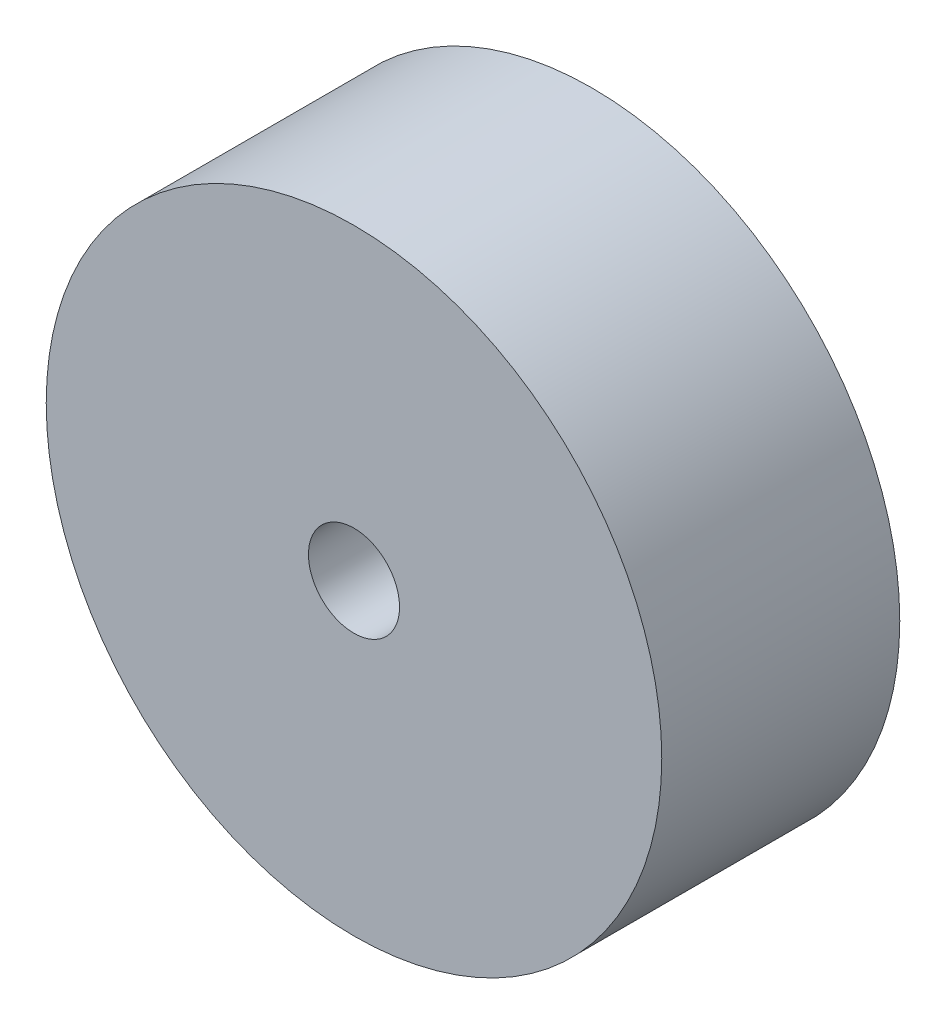
from build123d import *

# Parameters (mm, degrees)
SKETCH1_R           = 7.5
BOSS_EXTRUDE1_DEPTH = 5.8
SKETCH2_R           = 6.325
CUT_EXTRUDE1_DEPTH  = 1.5875
SKETCH3_R           = 1
BOSS_EXTRUDE2_DEPTH = 1.5875
SKETCH4_R           = 3.15
BOSS_EXTRUDE3_DEPTH = 3
SKETCH5_R           = 0.85
CUT_EXTRUDE2_DEPTH  = 39.165579588
SKETCH6_R           = 1.11
CUT_EXTRUDE3_DEPTH  = 3


with BuildPart() as part:
    # Sketch1 → Boss-Extrude1 (new body)
    with BuildSketch(Plane.XY):
        with Locations((-29.082250471, -1.703826149)):
            Circle(SKETCH1_R)
    extrude(amount=BOSS_EXTRUDE1_DEPTH)

    # Sketch2 → Cut-Extrude1 (cut)
    with BuildSketch(Plane(origin=(0, 0, 0), x_dir=(-1, 0, 0), z_dir=(0, 0, -1))):
        with Locations((29.082250471, -1.703826149)):
            Circle(SKETCH2_R)
    extrude(amount=-CUT_EXTRUDE1_DEPTH, mode=Mode.SUBTRACT)

    # Sketch3 → Boss-Extrude2 (add)
    with BuildSketch(Plane(origin=(0, 0, 1.5875), x_dir=(-1, 0, 0), z_dir=(0, 0, -1))):
        with Locations((29.082250471, -1.703826149)):
            Circle(SKETCH3_R)
    extrude(amount=BOSS_EXTRUDE2_DEPTH)

    # Sketch4 → Boss-Extrude3 (add)
    with BuildSketch(Plane(origin=(0, 0, 0), x_dir=(-1, 0, 0), z_dir=(0, 0, -1))):
        with Locations((29.082250471, -1.703826149)):
            Circle(SKETCH4_R)
    extrude(amount=-BOSS_EXTRUDE3_DEPTH)

    # Sketch5 → Cut-Extrude2 (cut, through all)
    with BuildSketch(Plane(origin=(0, 0, 0), x_dir=(-1, 0, 0), z_dir=(0, 0, -1))):
        with Locations((29.082250471, -1.703826149)):
            Circle(SKETCH5_R)
    extrude(amount=-CUT_EXTRUDE2_DEPTH, mode=Mode.SUBTRACT)

    # Sketch6 → Cut-Extrude3 (cut)
    with BuildSketch(Plane.XY.offset(5.8)):
        with Locations((-29.082250471, -1.703826149)):
            Circle(SKETCH6_R)
    extrude(amount=-CUT_EXTRUDE3_DEPTH, mode=Mode.SUBTRACT)


solid = part.part
